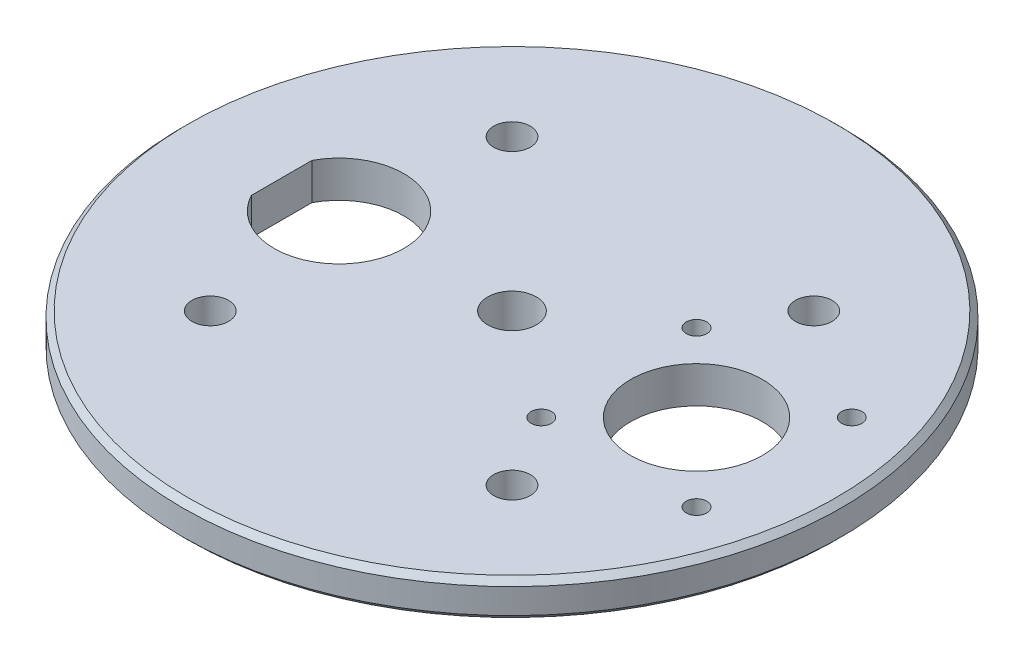
from build123d import *

# Parameters (mm, degrees)
SKETCH2_R           = 57.15
BOSS_EXTRUDE1_DEPTH = 6.35
CUT_EXTRUDE1_REACH  = 83.071
SKETCH6_R           = 3.175
SKETCH7_R           = 11.43
SKETCH7_R_2         = 1.778
CUT_EXTRUDE2_DEPTH  = 82.071372876
SKETCH8_R           = 4.2164
CUT_EXTRUDE3_DEPTH  = 82.071372876
CHAMFER1_SIZE       = 1


with BuildPart() as part:
    # Sketch2 → Boss-Extrude1 (new body)
    with BuildSketch(Plane(origin=(0, 0, 0), x_dir=(1, 0, 0), z_dir=(0, 1, 0))):
        Circle(SKETCH2_R)
    extrude(amount=BOSS_EXTRUDE1_DEPTH)

    # Sketch6 → Cut-Extrude1 (cut, up to next)
    with BuildSketch(Plane(origin=(0, 6.35, 0), x_dir=(1, 0, 0), z_dir=(0, 1, 0)), mode=Mode.PRIVATE) as cut_extrude1_sk1:
        with Locations((-26.1629, -26.1629)):
            Circle(SKETCH6_R)
    cut_extrude1_tool1 = extrude(cut_extrude1_sk1.sketch, amount=-CUT_EXTRUDE1_REACH, mode=Mode.PRIVATE) & part.part
    # Sketch6 → Cut-Extrude1 (cut, up to next)
    with BuildSketch(Plane(origin=(0, 6.35, 0), x_dir=(1, 0, 0), z_dir=(0, 1, 0)), mode=Mode.PRIVATE) as cut_extrude1_sk2:
        with Locations((26.1629, -26.1629)):
            Circle(SKETCH6_R)
    cut_extrude1_tool2 = extrude(cut_extrude1_sk2.sketch, amount=-CUT_EXTRUDE1_REACH, mode=Mode.PRIVATE) & part.part
    # Sketch6 → Cut-Extrude1 (cut, up to next)
    with BuildSketch(Plane(origin=(0, 6.35, 0), x_dir=(1, 0, 0), z_dir=(0, 1, 0)), mode=Mode.PRIVATE) as cut_extrude1_sk3:
        with Locations((-26.1629, 26.163103615)):
            Circle(SKETCH6_R)
    cut_extrude1_tool3 = extrude(cut_extrude1_sk3.sketch, amount=-CUT_EXTRUDE1_REACH, mode=Mode.PRIVATE) & part.part
    # Sketch6 → Cut-Extrude1 (cut, up to next)
    with BuildSketch(Plane(origin=(0, 6.35, 0), x_dir=(1, 0, 0), z_dir=(0, 1, 0)), mode=Mode.PRIVATE) as cut_extrude1_sk4:
        with Locations((26.1629, 26.163103615)):
            Circle(SKETCH6_R)
    cut_extrude1_tool4 = extrude(cut_extrude1_sk4.sketch, amount=-CUT_EXTRUDE1_REACH, mode=Mode.PRIVATE) & part.part
    add(cut_extrude1_tool1.solids().sort_by_distance((-26.1629, 6.35, 26.1629))[0], mode=Mode.SUBTRACT)
    add(cut_extrude1_tool2.solids().sort_by_distance((26.1629, 6.35, 26.1629))[0], mode=Mode.SUBTRACT)
    add(cut_extrude1_tool3.solids().sort_by_distance((-26.1629, 6.35, -26.163104))[0], mode=Mode.SUBTRACT)
    add(cut_extrude1_tool4.solids().sort_by_distance((26.1629, 6.35, -26.163104))[0], mode=Mode.SUBTRACT)

    # Sketch7 → Cut-Extrude2 (cut, through all)
    with BuildSketch(Plane(origin=(0, 6.35, 0), x_dir=(1, 0, 0), z_dir=(0, 1, 0))):
        with Locations((32, 0)):
            Circle(SKETCH7_R)
        with Locations((18.54, -13.464)):
            Circle(SKETCH7_R_2)
        with Locations((18.54, 13.46)):
            Circle(SKETCH7_R_2)
        with Locations((45.46, 13.46)):
            Circle(SKETCH7_R_2)
        with Locations((45.46, -13.464)):
            Circle(SKETCH7_R_2)
    extrude(amount=-CUT_EXTRUDE2_DEPTH, mode=Mode.SUBTRACT)

    # Sketch8 → Cut-Extrude3 (cut, through all)
    with BuildSketch(Plane(origin=(0, 6.35, 0), x_dir=(1, 0, 0), z_dir=(0, 1, 0))):
        Circle(SKETCH8_R)
        with BuildLine():
            Line((-39.95, 5.249761899), (-39.95, -5.249761899))
            ThreePointArc((-39.95, -5.249761899), (-18.75, 0), (-39.95, 5.249761899))
        make_face()
    extrude(amount=-CUT_EXTRUDE3_DEPTH, mode=Mode.SUBTRACT)

    # Chamfer1
    chamfer1_edges = [part.edges().sort_by_distance(p)[0] for p in [
        (-57.15, 0, 0),
        (-57.15, 6.35, 0),
    ]]
    chamfer(chamfer1_edges, length=CHAMFER1_SIZE)


solid = part.part
